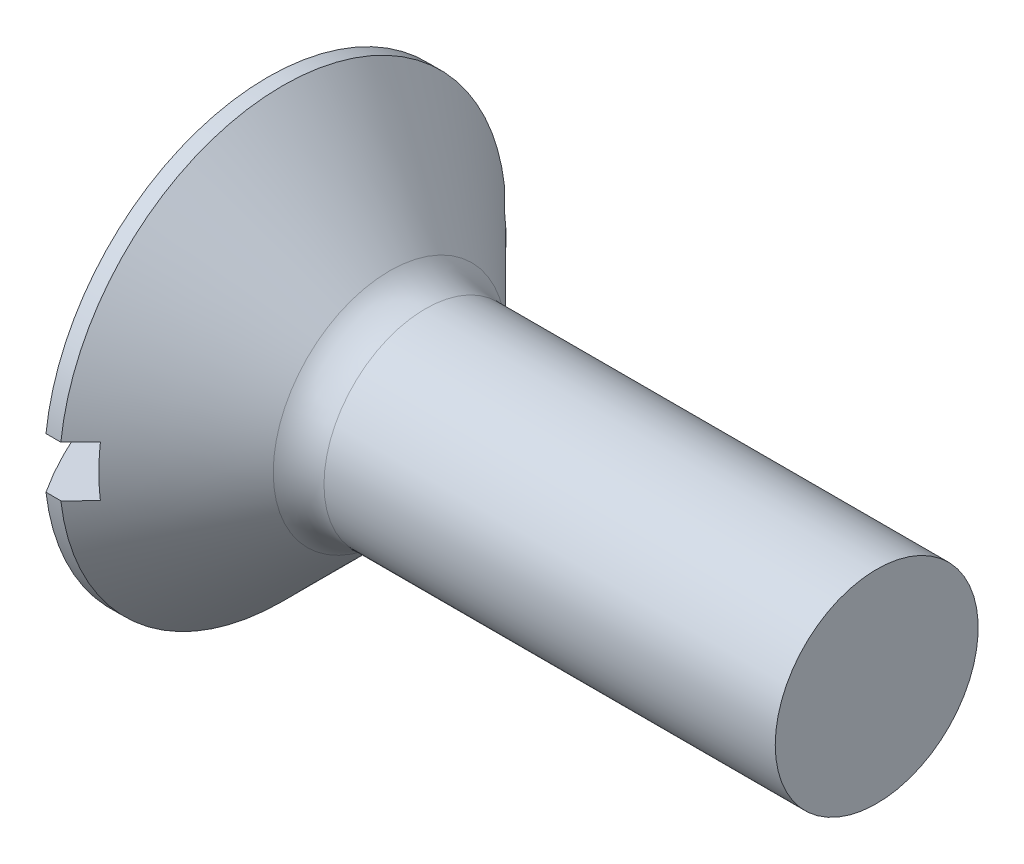
from build123d import *

# Parameters (mm, degrees)
SLOT_DEPTH      = 8.350294392
SLOT_DEPTH_BACK = 8.350294392
SKE_SLOT_W      = 1
SKE_SLOT_H      = 0.5


with BuildPart() as part:
    # Ske-Screw → Base (revolve)
    with BuildSketch(Plane.XY):
        with BuildLine():
            Line((0.659341382, 2.2), (0.805787992, 2.2))
            Line((0.805787992, 2.2), (1.859341382, 1.146446609))
            ThreePointArc((1.859341382, 1.146446609), (2.021553057, 1.038060234), (2.212894773, 1))
            Line((2.212894773, 1), (6.659341382, 1))
            Line((6.659341382, 1), (6.659341382, 0))
            Line((6.659341382, 0), (0.659341382, 0))
            Line((0.659341382, 0), (0, 0))
            ThreePointArc((0, 0), (0.168379294, 1.148339133), (0.659341382, 2.2))
        make_face()
    revolve(axis=Axis((-1.349906986, 0, 0), (1, 0, 0)))

    # Ske-Slot → Slot (cut, two sides: drawn at the far end of the back side and taken through both)
    with BuildSketch(Plane.XY.offset(-SLOT_DEPTH_BACK)):
        with Locations((0.5, 0)):
            Rectangle(SKE_SLOT_W, SKE_SLOT_H)
    extrude(amount=SLOT_DEPTH + SLOT_DEPTH_BACK, mode=Mode.SUBTRACT)


solid = part.part
